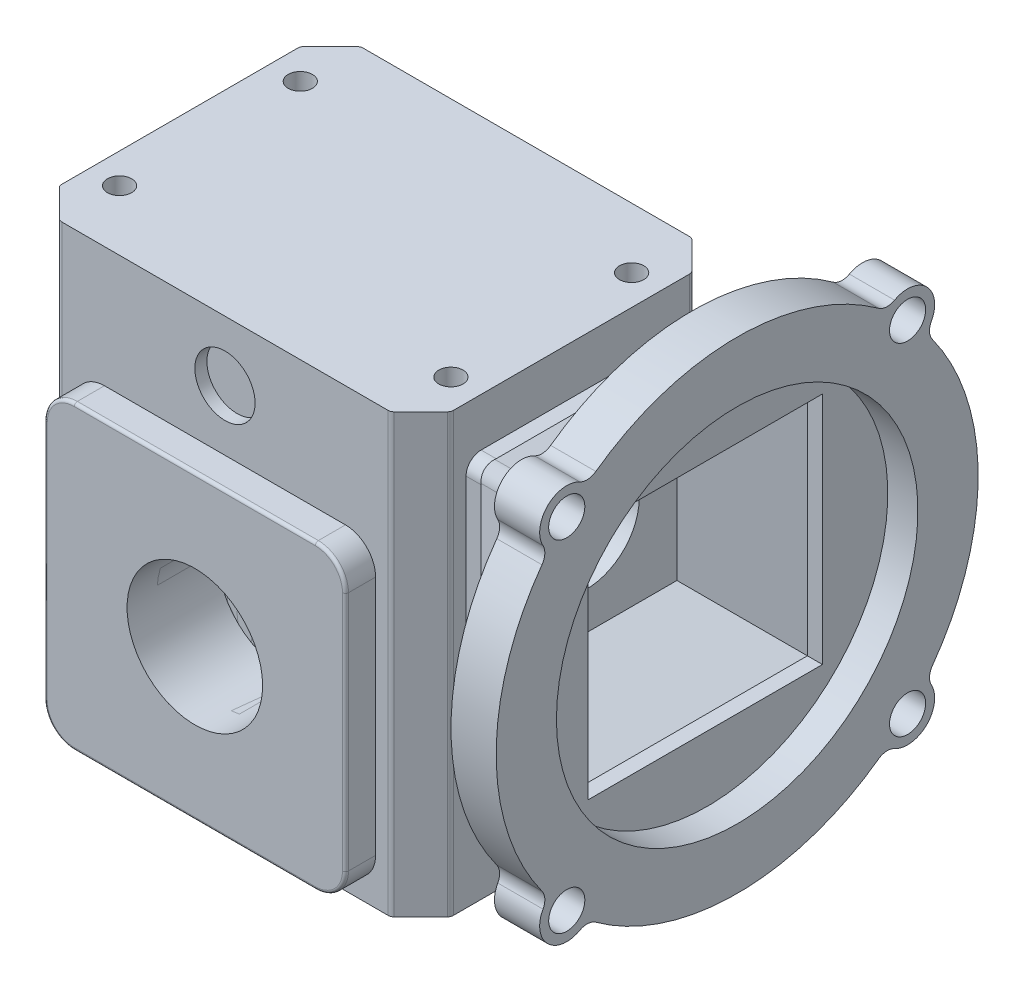
from build123d import *

# Parameters (mm, degrees)
SKETCH1_W                            = 82.55
SKETCH1_H                            = 63.5
BOSS_EXTRUDE1_DEPTH                  = 46.101
CHAMFER1_SIZE                        = 6.35
BOSS_EXTRUDE2_DEPTH                  = 6.35
BOSS_EXTRUDE2_DEPTH_BACK             = 69.85
SKETCH2_W                            = 63.5
SKETCH2_H                            = 63.5
FILLET1_R                            = 6.35
FILLET2_R                            = 0.635
FILLET3_R                            = 1.27
SKETCH3_R                            = 14.2875
CUT_EXTRUDE1_DEPTH                   = 19.05
SKETCH4_W                            = 44.45
SKETCH4_H                            = 44.45
BOSS_EXTRUDE3_DEPTH                  = 3.175
FILLET4_R                            = 3.175
SKETCH7_R                            = 38.1
SKETCH7_W                            = 49.391408666
SKETCH7_H                            = 49.391408666
BOSS_EXTRUDE4_DEPTH                  = 3.175
SKETCH8_R                            = 50.8
SKETCH8_R_2                          = 38.1
BOSS_EXTRUDE5_DEPTH                  = 9.525
SKETCH12_R                           = 5.715
SKETCH12_R_2                         = 3.81
BOSS_EXTRUDE6_DEPTH                  = 9.525
SKETCH13_R                           = 3.81
CUT_EXTRUDE2_DEPTH                   = 9.525
FILLET5_R                            = 3.175
SKETCH14_R                           = 11.1125
CUT_EXTRUDE3_DEPTH                   = 6.35
TAP_DRILL_FOR_1_4_20_TAP1_AT_2_COUNT = 2
TAP_DRILL_FOR_1_4_20_TAP1_AT_2_PITCH = 38.1
TAP_DRILL_FOR_1_4_20_TAP1_AT_3_COUNT = 2
TAP_DRILL_FOR_1_4_20_TAP1_AT_3_PITCH = 69.85
TAP_DRILL_FOR_1_4_20_TAP1_AT_4_COUNT = 2
TAP_DRILL_FOR_1_4_20_TAP1_AT_4_PITCH = 79.565271947
SKETCH18_R                           = 6.35
CUT_EXTRUDE4_DEPTH                   = 2.54
SKETCH19_R                           = 3.175
CUT_EXTRUDE5_DEPTH                   = 12.7


with BuildPart() as part:
    # Sketch1 → Boss-Extrude1 (new, symmetric)
    with BuildSketch(Plane(origin=(0, 0, 0), x_dir=(1, 0, 0), z_dir=(0, 1, 0))):
        Rectangle(SKETCH1_W, SKETCH1_H)
    extrude(amount=BOSS_EXTRUDE1_DEPTH, both=True)

    # Chamfer1
    chamfer1_edges = [part.edges().sort_by_distance(p)[0] for p in [
        (41.275, 0, 31.75),
        (-41.275, 0, 31.75),
        (-41.275, 0, -31.75),
        (41.275, 0, -31.75),
    ]]
    chamfer(chamfer1_edges, length=CHAMFER1_SIZE)

    # Fillet3
    fillet3_edges = [part.edges().sort_by_distance(p)[0] for p in [
        (-34.925, 0, -31.75),
        (34.925, 0, -31.75),
        (41.275, 0, 25.4),
        (41.275, 0, -25.4),
        (-41.275, 0, 25.4),
        (-41.275, 0, -25.4),
        (34.925, 0, 31.75),
        (-34.925, 0, 31.75),
    ]]
    fillet(fillet3_edges, radius=FILLET3_R)


with BuildPart() as body_2:
    # Sketch2 → Boss-Extrude2 (new, two sides: drawn at the far end of the back side and taken through both)
    with BuildSketch(Plane.XY.offset(31.75).offset(-BOSS_EXTRUDE2_DEPTH_BACK)):
        with Locations((0, -11.049)):
            Rectangle(SKETCH2_W, SKETCH2_H)
    extrude(amount=BOSS_EXTRUDE2_DEPTH + BOSS_EXTRUDE2_DEPTH_BACK)

    # Fillet1
    fillet1_edges = [body_2.edges().sort_by_distance(p)[0] for p in [
        (-31.75, 20.701, 0),
        (31.75, 20.701, 0),
        (31.75, -42.799, 0),
        (-31.75, -42.799, 0),
    ]]
    fillet(fillet1_edges, radius=FILLET1_R)

    # Fillet2
    fillet2_edges = [body_2.edges().sort_by_distance(p)[0] for p in [
        (-31.75, -11.049, 38.1),
        (-31.75, -11.049, -38.1),
        (0, -42.799, 38.1),
        (31.75, -11.049, 38.1),
        (0, 20.701, 38.1),
        (-29.890128061, 18.841128061, 38.1),
        (29.890128061, 18.841128061, 38.1),
        (29.890128061, -40.939128061, 38.1),
        (-29.890128061, -40.939128061, 38.1),
        (0, -42.799, -38.1),
        (0, 20.701, -38.1),
        (31.75, -11.049, -38.1),
        (-29.890128061, 18.841128061, -38.1),
        (29.890128061, 18.841128061, -38.1),
        (29.890128061, -40.939128061, -38.1),
        (-29.890128061, -40.939128061, -38.1),
    ]]
    fillet(fillet2_edges, radius=FILLET2_R)


with BuildPart() as cut_extrude1_tool:
    # Sketch3 → Cut-Extrude1 (new body)
    with BuildSketch(Plane.XY.offset(38.1)):
        with Locations((0, -11.049)):
            Circle(SKETCH3_R)
    extrude(amount=-CUT_EXTRUDE1_DEPTH)


with BuildPart() as part_1:
    add(part.part)

    # Cut-Extrude1: cut by cut_extrude1_tool
    add(cut_extrude1_tool.part, mode=Mode.SUBTRACT)

    # Sketch4 → Boss-Extrude3 (add)
    with BuildSketch(Plane(origin=(41.275, 0, 0), x_dir=(0, 0, -1), z_dir=(1, 0, 0))):
        with Locations((0.018051224, 13.716)):
            Rectangle(SKETCH4_W, SKETCH4_H)
    extrude(amount=BOSS_EXTRUDE3_DEPTH)

    # Sweep1: sweep along a path in Sketch6
    with BuildLine(Plane(origin=(44.45, 0, 0), x_dir=(0, 0, -1), z_dir=(1, 0, 0))) as sweep1_path:
        Line((-22.206948776, 35.941), (22.243051224, 35.941))
        Line((22.243051224, 35.941), (22.243051224, -8.509))
        Line((22.243051224, -8.509), (-22.206948776, -8.509))
        Line((-22.206948776, -8.509), (-22.206948776, 35.941))
    # Sketch5 → Sweep1 (sweep)
    with BuildSketch(Plane.XY):
        Polygon((44.45, 35.941), (66.675, 45.466), (66.675, 42.291), (44.45, 32.766), align=None)
    sweep(path=sweep1_path.line, transition=Transition.RIGHT)

    # Fillet4
    fillet4_edges = [part_1.edges().sort_by_distance(p)[0] for p in [
        (42.8625, -8.509, 22.206948776),
    ]]
    fillet(fillet4_edges, radius=FILLET4_R)
    fillet4_2_edges = [part_1.edges().sort_by_distance(p)[0] for p in [
        (42.8625, 35.941, 22.206948776),
    ]]
    fillet(fillet4_2_edges, radius=FILLET4_R)
    fillet4_3_edges = [part_1.edges().sort_by_distance(p)[0] for p in [
        (42.8625, -8.509, -22.243051224),
    ]]
    fillet(fillet4_3_edges, radius=FILLET4_R)
    fillet4_4_edges = [part_1.edges().sort_by_distance(p)[0] for p in [
        (42.8625, 35.941, -22.243051224),
    ]]
    fillet(fillet4_4_edges, radius=FILLET4_R)
    fillet4_5_edges = [part_1.edges().sort_by_distance(p)[0] for p in [
        (54.477574702, -12.806532015, 26.504480791),
    ]]
    fillet(fillet4_5_edges, radius=FILLET4_R)
    fillet4_6_edges = [part_1.edges().sort_by_distance(p)[0] for p in [
        (54.477574702, 40.238532015, 26.504480791),
    ]]
    fillet(fillet4_6_edges, radius=FILLET4_R)
    fillet4_7_edges = [part_1.edges().sort_by_distance(p)[0] for p in [
        (54.477574702, -12.806532015, -26.540583239),
    ]]
    fillet(fillet4_7_edges, radius=FILLET4_R)
    fillet4_8_edges = [part_1.edges().sort_by_distance(p)[0] for p in [
        (54.477574702, 40.238532015, -26.540583239),
    ]]
    fillet(fillet4_8_edges, radius=FILLET4_R)

    # Sketch7 → Boss-Extrude4 (add)
    with BuildSketch(Plane(origin=(66.675, 0, 0), x_dir=(0, 0, -1), z_dir=(1, 0, 0))):
        with Locations(Location((0.018051224, 13.716, 0), (0, 0, 213.557309762))):
            Circle(SKETCH7_R)
        with Locations((-0.349703585, 14.083754809)):
            Rectangle(SKETCH7_W, SKETCH7_H, mode=Mode.SUBTRACT)
    extrude(amount=BOSS_EXTRUDE4_DEPTH)

    # Sketch8 → Boss-Extrude5 (add)
    with BuildSketch(Plane(origin=(66.675, 0, 0), x_dir=(0, 0, -1), z_dir=(1, 0, 0))):
        with Locations(Location((0.018051224, 13.716, 0), (0, 0, 180))):
            Circle(SKETCH8_R)
        with Locations(Location((0.018051224, 13.716, 0), (0, 0, 180))):
            Circle(SKETCH8_R_2, mode=Mode.SUBTRACT)
    extrude(amount=BOSS_EXTRUDE5_DEPTH)

    # Sketch12 → Boss-Extrude6 (add)
    # profile 1 of 4: a face of its own
    with BuildSketch(Plane(origin=(76.2, 0, 0), x_dir=(0, 0, -1), z_dir=(1, 0, 0))):
        with Locations((-35.90297326, 49.637024484)):
            Circle(SKETCH12_R)
        with Locations((-35.90297326, 49.637024484)):
            Circle(SKETCH12_R_2, mode=Mode.SUBTRACT)
    # profile 2 of 4: a face of its own
    with BuildSketch(Plane(origin=(76.2, 0, 0), x_dir=(0, 0, -1), z_dir=(1, 0, 0))):
        with Locations((-35.90297326, -22.205024484)):
            Circle(SKETCH12_R)
        with Locations((-35.90297326, -22.205024484)):
            Circle(SKETCH12_R_2, mode=Mode.SUBTRACT)
    # profile 3 of 4: a face of its own
    with BuildSketch(Plane(origin=(76.2, 0, 0), x_dir=(0, 0, -1), z_dir=(1, 0, 0))):
        with Locations((35.939075708, -22.205024484)):
            Circle(SKETCH12_R)
        with Locations((35.939075708, -22.205024484)):
            Circle(SKETCH12_R_2, mode=Mode.SUBTRACT)
    # profile 4 of 4: a face of its own
    with BuildSketch(Plane(origin=(76.2, 0, 0), x_dir=(0, 0, -1), z_dir=(1, 0, 0))):
        with Locations((35.939075708, 49.637024484)):
            Circle(SKETCH12_R)
        with Locations((35.939075708, 49.637024484)):
            Circle(SKETCH12_R_2, mode=Mode.SUBTRACT)
    extrude(amount=-BOSS_EXTRUDE6_DEPTH)

    # Sketch13 → Cut-Extrude2 (cut)
    with BuildSketch(Plane(origin=(76.2, 0, 0), x_dir=(0, 0, -1), z_dir=(1, 0, 0))):
        with Locations((-35.90297326, 49.637024484)):
            Circle(SKETCH13_R)
        with Locations((35.939075708, 49.637024484)):
            Circle(SKETCH13_R)
        with Locations((35.939075708, -22.205024484)):
            Circle(SKETCH13_R)
        with Locations((-35.90297326, -22.205024484)):
            Circle(SKETCH13_R)
    extrude(amount=-CUT_EXTRUDE2_DEPTH, mode=Mode.SUBTRACT)

    # Fillet5
    fillet5_edges = [part_1.edges().sort_by_distance(p)[0] for p in [
        (71.4375, 53.44442877, 31.640943508),
        (71.4375, 45.374994732, 39.710377546),
        (71.4375, -17.942994732, 39.710377546),
        (71.4375, -26.01242877, 31.640943508),
        (71.4375, -26.01242877, -31.677045957),
        (71.4375, -17.942994732, -39.746479994),
        (71.4375, 45.374994732, -39.746479994),
        (71.4375, 53.44442877, -31.677045957),
    ]]
    fillet(fillet5_edges, radius=FILLET5_R)

    # Sketch14 → Cut-Extrude3 (cut)
    with BuildSketch(Plane(origin=(44.45, 0, 0), x_dir=(0, 0, -1), z_dir=(1, 0, 0))):
        with Locations((0.018051224, 13.716)):
            Circle(SKETCH14_R)
    extrude(amount=-CUT_EXTRUDE3_DEPTH, mode=Mode.SUBTRACT)

    # Sketch16 → Tap Drill for 1/4-20 Tap1 (revolve, cut)
    with BuildSketch(Plane(origin=(-34.925, 46.101, -19.05), x_dir=(0, 0, 1), z_dir=(1, 0, 0))):
        Polygon((0, 0), (0, 17.535816902), (2.5527, 16.002), (2.5527, 0), align=None)
    tap_drill_for_1_4_20_tap1 = revolve(axis=Axis((-34.925, 52.451, -19.05), (0, -1, 0)), mode=Mode.SUBTRACT)

    # Tap Drill for 1/4-20 Tap1 at 2: Tap Drill for 1/4-20 Tap1 ×2
    with Locations(*[(0, 0, i * TAP_DRILL_FOR_1_4_20_TAP1_AT_2_PITCH) for i in range(1, TAP_DRILL_FOR_1_4_20_TAP1_AT_2_COUNT)]):
        add(tap_drill_for_1_4_20_tap1, mode=Mode.SUBTRACT)

    # Tap Drill for 1/4-20 Tap1 at 3: Tap Drill for 1/4-20 Tap1 ×2
    with Locations(*[(i * TAP_DRILL_FOR_1_4_20_TAP1_AT_3_PITCH, 0, 0) for i in range(1, TAP_DRILL_FOR_1_4_20_TAP1_AT_3_COUNT)]):
        add(tap_drill_for_1_4_20_tap1, mode=Mode.SUBTRACT)

    # Tap Drill for 1/4-20 Tap1 at 4: Tap Drill for 1/4-20 Tap1 ×2
    with Locations(*[Vector(0.8778955729143846, 0, 0.478852130680573) * (i * TAP_DRILL_FOR_1_4_20_TAP1_AT_4_PITCH) for i in range(1, TAP_DRILL_FOR_1_4_20_TAP1_AT_4_COUNT)]):
        add(tap_drill_for_1_4_20_tap1, mode=Mode.SUBTRACT)

    # Sketch18 → Cut-Extrude4 (cut)
    with BuildSketch(Plane.XY.offset(31.75)):
        with Locations((0, 33.401)):
            Circle(SKETCH18_R)
    extrude(amount=-CUT_EXTRUDE4_DEPTH, mode=Mode.SUBTRACT)

    # Sketch19 → Cut-Extrude5 (cut)
    with BuildSketch(Plane.XZ.offset(46.101)):
        with Locations(Location((-34.925, -19.05, 0), (0, 0, 270))):
            Circle(SKETCH19_R)
        with Locations(Location((34.925, -19.05, 0), (0, 0, 270))):
            Circle(SKETCH19_R)
        with Locations(Location((34.925, 19.05, 0), (0, 0, 270))):
            Circle(SKETCH19_R)
        with Locations(Location((-34.925, 19.05, 0), (0, 0, 270))):
            Circle(SKETCH19_R)
    extrude(amount=-CUT_EXTRUDE5_DEPTH, mode=Mode.SUBTRACT)


with BuildPart() as body_2_1:
    add(body_2.part)

    # Cut-Extrude1: cut by cut_extrude1_tool
    add(cut_extrude1_tool.part, mode=Mode.SUBTRACT)


solid = Compound([part_1.part, body_2_1.part])
